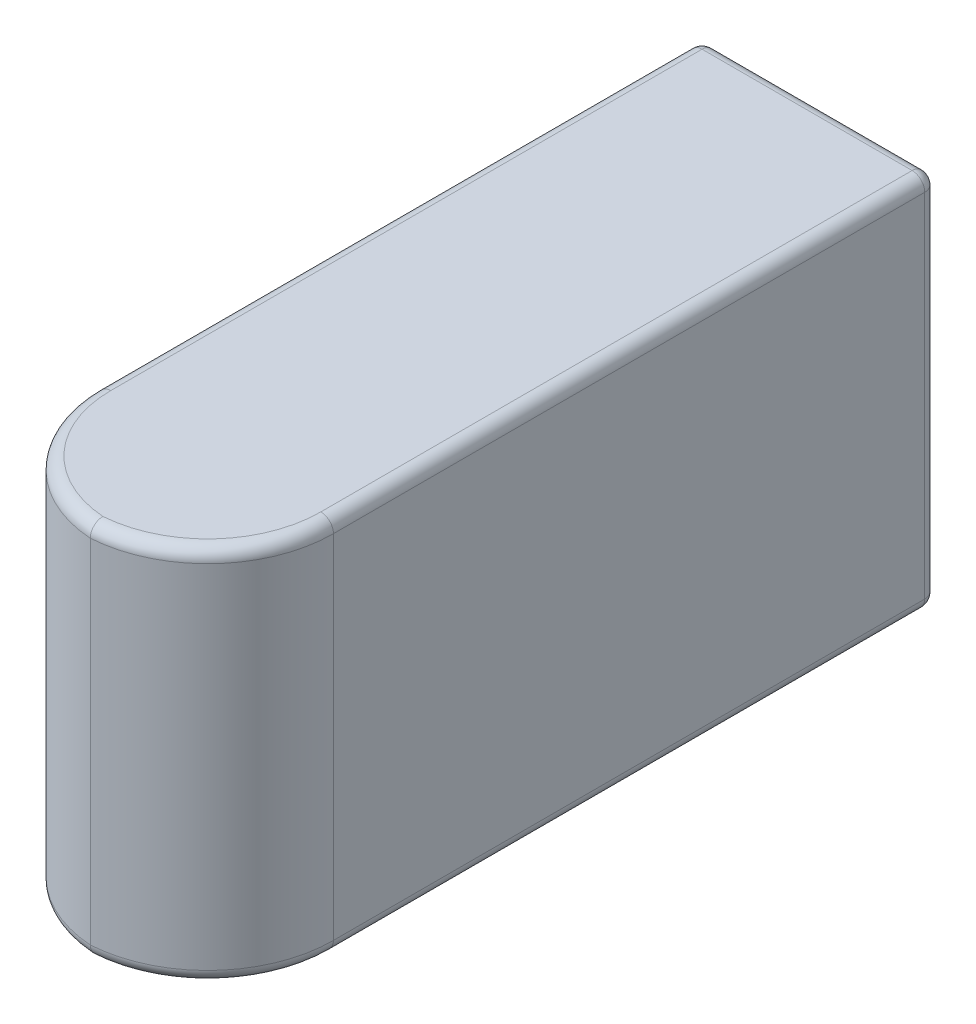
from build123d import *

# Parameters (mm, degrees)
SKETCH2_W           = 58
SKETCH2_H           = 30
BOSS_EXTRUDE1_DEPTH = 18.7
FILLET1_R           = 10
FILLET2_R           = 1


with BuildPart() as part:
    # Sketch2 → Boss-Extrude1 (new body)
    with BuildSketch(Plane(origin=(0, 0, 0), x_dir=(0, 0, -1), z_dir=(1, 0, 0))):
        Rectangle(SKETCH2_W, SKETCH2_H)
    extrude(amount=BOSS_EXTRUDE1_DEPTH)

    # Fillet1
    # the kernel refuses this fillet: 10 mm, written as the material it takes off along each edge
    with BuildSketch(Plane(origin=(0, -40, 29), x_dir=(1, 0, 0), z_dir=(0, 1, 0))) as fillet1_piece_1:
        with BuildLine():
            CenterArc((FILLET1_R, FILLET1_R), FILLET1_R, 180, 90)
            Line((0, FILLET1_R), (0, 0))
            Line((0, 0), (FILLET1_R, 0))
        make_face()
    extrude(amount=80, mode=Mode.SUBTRACT)
    with BuildSketch(Plane(origin=(18.7, -40, 29), x_dir=(-1, 0, 0), z_dir=(0, 1, 0))) as fillet1_piece_2:
        with BuildLine():
            CenterArc((FILLET1_R, -FILLET1_R), FILLET1_R, 90, 90)
            Line((0, -FILLET1_R), (0, 0))
            Line((0, 0), (FILLET1_R, 0))
        make_face()
    extrude(amount=80, mode=Mode.SUBTRACT)

    # Fillet2
    # the kernel refuses this fillet: 1 mm, written as the material it takes off along each edge
    with BuildSketch(Plane(origin=(1, -14, -28), x_dir=(0, 0, -1), z_dir=(-1, 0, 0))) as fillet2_piece_1_section:
        Polygon((0, 0), (FILLET2_R, 0), (FILLET2_R, FILLET2_R), (0, FILLET2_R), align=None)
    fillet2_piece_1 = extrude(amount=FILLET2_R, mode=Mode.PRIVATE)
    fillet2_piece_1 = fillet2_piece_1 - Plane(origin=(1, -14, -28), x_dir=(0, 0.7071067811865475, 0.7071067811865475), z_dir=(-1, 0, 0)) * Sphere(FILLET2_R, mode=Mode.PRIVATE)
    add(fillet2_piece_1, mode=Mode.SUBTRACT)
    with BuildSketch(Plane(origin=(17.7, -14, -28), x_dir=(1, 0, 0), z_dir=(0, 0, -1))) as fillet2_piece_2_section:
        Polygon((0, 0), (FILLET2_R, 0), (FILLET2_R, FILLET2_R), (0, FILLET2_R), align=None)
    fillet2_piece_2 = extrude(amount=FILLET2_R, mode=Mode.PRIVATE)
    fillet2_piece_2 = fillet2_piece_2 - Plane(origin=(17.7, -14, -28), x_dir=(-0.7071067811865475, 0.7071067811865475, 0), z_dir=(0, 0, -1)) * Sphere(FILLET2_R, mode=Mode.PRIVATE)
    add(fillet2_piece_2, mode=Mode.SUBTRACT)
    with BuildSketch(Plane(origin=(1, 14, -28), x_dir=(-1, 0, 0), z_dir=(0, 1, 0))) as fillet2_piece_3_section:
        Polygon((0, 0), (FILLET2_R, 0), (FILLET2_R, -FILLET2_R), (0, -FILLET2_R), align=None)
    fillet2_piece_3 = extrude(amount=FILLET2_R, mode=Mode.PRIVATE)
    fillet2_piece_3 = fillet2_piece_3 - Plane(origin=(1, 14, -28), x_dir=(0.7071067811865475, 0, 0.7071067811865475), z_dir=(0, 1, 0)) * Sphere(FILLET2_R, mode=Mode.PRIVATE)
    add(fillet2_piece_3, mode=Mode.SUBTRACT)
    with BuildSketch(Plane(origin=(17.7, 14, -28), x_dir=(0, 0, -1), z_dir=(0, 1, 0))) as fillet2_piece_4_section:
        Polygon((0, 0), (FILLET2_R, 0), (FILLET2_R, -FILLET2_R), (0, -FILLET2_R), align=None)
    fillet2_piece_4 = extrude(amount=FILLET2_R, mode=Mode.PRIVATE)
    fillet2_piece_4 = fillet2_piece_4 - Plane(origin=(17.7, 14, -28), x_dir=(-0.7071067811865475, 0, 0.7071067811865475), z_dir=(0, 1, 0)) * Sphere(FILLET2_R, mode=Mode.PRIVATE)
    add(fillet2_piece_4, mode=Mode.SUBTRACT)
    with BuildSketch(Plane(origin=(0, -15, -28), x_dir=(0, 1, 0), z_dir=(0, 0, 1)), Plane(origin=(18.7, 15, 19), x_dir=(-1, 0, 0), z_dir=(0, 0, -1))) as fillet2_piece_5:
        with BuildLine():
            CenterArc((FILLET2_R, -FILLET2_R), FILLET2_R, 90, 90)
            Line((0, -FILLET2_R), (0, 0))
            Line((0, 0), (FILLET2_R, 0))
        make_face()
    extrude(amount=47, mode=Mode.SUBTRACT)
    with BuildSketch(Plane(origin=(18.7, -15, -28), x_dir=(0, 1, 0), z_dir=(0, 0, 1)), Plane(origin=(0, 15, 19), x_dir=(1, 0, 0), z_dir=(0, 0, -1))) as fillet2_piece_6:
        with BuildLine():
            CenterArc((FILLET2_R, FILLET2_R), FILLET2_R, 180, 90)
            Line((0, FILLET2_R), (0, 0))
            Line((0, 0), (FILLET2_R, 0))
        make_face()
    extrude(amount=47, mode=Mode.SUBTRACT)
    with BuildSketch(Plane(origin=(8.7, -15, 19), x_dir=(1, 0, 0), z_dir=(0, 0, -1))) as fillet2_piece_7:
        with BuildLine():
            CenterArc((10 - FILLET2_R, -FILLET2_R), FILLET2_R, 0, 90)
            Line((10 - FILLET2_R, 0), (10, 0))
            Line((10, 0), (10, -FILLET2_R))
        make_face()
    revolve(axis=Axis((8.7, -15, 19), (0, -1, 0)), revolution_arc=100.602378983, mode=Mode.SUBTRACT)
    with BuildSketch(Plane(origin=(10, -15, 19), x_dir=(0.1839921630034736, 0, 0.9829277104412629), z_dir=(0.9829277104412629, 0, -0.1839921630034736))) as fillet2_piece_8:
        with BuildLine():
            CenterArc((10 - FILLET2_R, -FILLET2_R), FILLET2_R, 0, 90)
            Line((10 - FILLET2_R, 0), (10, 0))
            Line((10, 0), (10, -FILLET2_R))
        make_face()
    revolve(axis=Axis((10, -15, 19), (0, -1, 0)), revolution_arc=100.602378983, mode=Mode.SUBTRACT)
    with BuildSketch(Plane(origin=(8.7, 15, 19), x_dir=(1, 0, 0), z_dir=(0, 0, -1))) as fillet2_piece_9:
        with BuildLine():
            CenterArc((10 - FILLET2_R, FILLET2_R), FILLET2_R, 270, 90)
            Line((10, FILLET2_R), (10, 0))
            Line((10, 0), (10 - FILLET2_R, 0))
        make_face()
    revolve(axis=Axis((8.7, 15, 19), (0, -1, 0)), revolution_arc=100.602378983, mode=Mode.SUBTRACT)
    with BuildSketch(Plane(origin=(10, 15, 19), x_dir=(0.1839921630034736, 0, 0.9829277104412629), z_dir=(0.9829277104412629, 0, -0.1839921630034736))) as fillet2_piece_10:
        with BuildLine():
            CenterArc((10 - FILLET2_R, FILLET2_R), FILLET2_R, 270, 90)
            Line((10, FILLET2_R), (10, 0))
            Line((10, 0), (10 - FILLET2_R, 0))
        make_face()
    revolve(axis=Axis((10, 15, 19), (0, -1, 0)), revolution_arc=100.602378983, mode=Mode.SUBTRACT)
    with BuildSketch(Plane(origin=(0, 14, -29), x_dir=(0, 0, 1), z_dir=(0, -1, 0)), Plane(origin=(18.7, 14, -29), x_dir=(-1, 0, 0), z_dir=(0, -1, 0))) as fillet2_piece_11:
        with BuildLine():
            CenterArc((FILLET2_R, -FILLET2_R), FILLET2_R, 90, 90)
            Line((0, -FILLET2_R), (0, 0))
            Line((0, 0), (FILLET2_R, 0))
        make_face()
    extrude(amount=28, mode=Mode.SUBTRACT)
    with BuildSketch(Plane(origin=(1, -15, -29), x_dir=(0, 1, 0), z_dir=(1, 0, 0)), Plane(origin=(1, 15, -29), x_dir=(0, 0, 1), z_dir=(1, 0, 0))) as fillet2_piece_12:
        with BuildLine():
            CenterArc((FILLET2_R, FILLET2_R), FILLET2_R, 180, 90)
            Line((0, FILLET2_R), (0, 0))
            Line((0, 0), (FILLET2_R, 0))
        make_face()
    extrude(amount=16.7, mode=Mode.SUBTRACT)


solid = part.part
